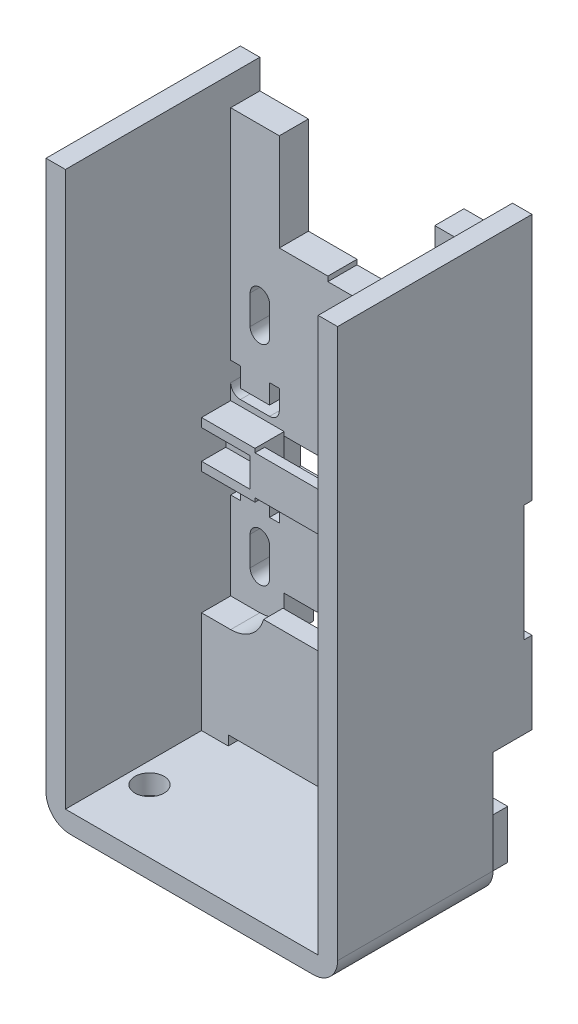
from build123d import *

# Parameters (mm, degrees)
BOSS_EXTRUDE1_DEPTH = 20
CUT_EXTRUDE1_DEPTH  = 39.668462602
CUT_EXTRUDE2_DEPTH  = 39.668462602
SKETCH4_W           = 26
SKETCH4_H           = 57
CUT_EXTRUDE3_DEPTH  = 14
CUT_EXTRUDE4_DEPTH  = 0.8
CUT_EXTRUDE5_DEPTH  = 39.260815464
CUT_EXTRUDE6_DEPTH  = 4
SKETCH8_W           = 5
SKETCH8_H           = 6.5
BOSS_EXTRUDE2_DEPTH = 1
SKETCH9_W           = 20.5
SKETCH9_H           = 1
CUT_EXTRUDE7_DEPTH  = 39.668462602
SKETCH10_W          = 11.5
SKETCH10_H          = 2
CUT_EXTRUDE8_DEPTH  = 1
CUT_EXTRUDE9_DEPTH  = 3
CUT_EXTRUDE10_REACH = 40.668
SKETCH12_W          = 15
SKETCH12_H          = 2
SKETCH13_W          = 16
SKETCH13_H          = 4
CUT_EXTRUDE11_DEPTH = 2.2
SKETCH14_W          = 5
SKETCH14_H          = 3
CUT_EXTRUDE12_DEPTH = 2.5
CUT_EXTRUDE13_REACH = 66.078
SKETCH15_R          = 1.5


with BuildPart() as part:
    # Sketch1 → Boss-Extrude1 (new body)
    with BuildSketch(Plane.XY):
        with BuildLine():
            Line((-15, 29.5), (15, 29.5))
            Line((15, 29.5), (15, -27))
            ThreePointArc((15, -27), (14.267766953, -28.767766953), (12.5, -29.5))
            Line((12.5, -29.5), (-12.5, -29.5))
            ThreePointArc((-12.5, -29.5), (-14.267766953, -28.767766953), (-15, -27))
            Line((-15, -27), (-15, 29.5))
        make_face()
    extrude(amount=BOSS_EXTRUDE1_DEPTH)

    # Sketch2 → Cut-Extrude1 (cut, through all)
    with BuildSketch(Plane(origin=(0, 0, 0), x_dir=(-1, 0, 0), z_dir=(0, 0, -1))):
        Polygon((-13, 29.5), (-13, 26.5), (-8, 26.5), (-8, 16.5), (-3, 16.5), (-3, 16), (3, 16), (3, 16.5), (8, 16.5), (8, 26.5), (13, 26.5), (13, 29.5), align=None)
    extrude(amount=-CUT_EXTRUDE1_DEPTH, mode=Mode.SUBTRACT)

    # Sketch3 → Cut-Extrude2 (cut, through all)
    with BuildSketch(Plane(origin=(0, 0, 0), x_dir=(-1, 0, 0), z_dir=(0, 0, -1))):
        with BuildLine():
            Line((-9, 11), (-9, 8))
            ThreePointArc((-9, 8), (-10, 7), (-11, 8))
            Line((-11, 8), (-11, 11))
            ThreePointArc((-11, 11), (-10, 12), (-9, 11))
        make_face()
        with BuildLine():
            Line((9, 8), (9, 11))
            ThreePointArc((9, 11), (10, 12), (11, 11))
            Line((11, 11), (11, 8))
            ThreePointArc((11, 8), (10, 7), (9, 8))
        make_face()
        with BuildLine():
            Line((9, -13.5), (9, -10.5))
            ThreePointArc((9, -10.5), (10, -9.5), (11, -10.5))
            Line((11, -10.5), (11, -13.5))
            ThreePointArc((11, -13.5), (10, -14.5), (9, -13.5))
        make_face()
        with BuildLine():
            Line((-9, -10.5), (-9, -13.5))
            ThreePointArc((-9, -13.5), (-10, -14.5), (-11, -13.5))
            Line((-11, -13.5), (-11, -10.5))
            ThreePointArc((-11, -10.5), (-10, -9.5), (-9, -10.5))
        make_face()
    extrude(amount=-CUT_EXTRUDE2_DEPTH, mode=Mode.SUBTRACT)

    # Sketch4 → Cut-Extrude3 (cut)
    with BuildSketch(Plane.XY.offset(20)):
        with Locations((0, 1)):
            Rectangle(SKETCH4_W, SKETCH4_H)
    extrude(amount=-CUT_EXTRUDE3_DEPTH, mode=Mode.SUBTRACT)

    # Sketch5 → Cut-Extrude4 (cut)
    with BuildSketch(Plane(origin=(0, 0, 0), x_dir=(-1, 0, 0), z_dir=(0, 0, -1))):
        Polygon((-15, 4), (-12, 4), (-12, 2), (-9, 2), (-9, 4), (9, 4), (9, 2), (12, 2), (12, 4), (15, 4), (15, -8), (12, -8), (12, -6), (9, -6), (9, -8), (5.5, -8), (5.5, -14), (-5.5, -14), (-5.5, -8), (-9, -8), (-9, -6), (-12, -6), (-12, -8), (-15, -8), align=None)
    extrude(amount=-CUT_EXTRUDE4_DEPTH, mode=Mode.SUBTRACT)

    # Sketch6 → Cut-Extrude5 (cut, through all)
    with BuildSketch(Plane(origin=(0, 0, 0.8), x_dir=(-1, 0, 0), z_dir=(0, 0, -1))):
        with BuildLine():
            Line((-12, 4), (-12, 2))
            Line((-12, 2), (-9, 2))
            Line((-9, 2), (-9, 4))
            Line((-9, 4), (-8, 4))
            Line((-8, 4), (-8, 2))
            ThreePointArc((-8, 2), (-8.292893219, 1.292893219), (-9, 1))
            Line((-9, 1), (-12, 1))
            ThreePointArc((-12, 1), (-12.707106781, 1.292893219), (-13, 2))
            Line((-13, 2), (-13, 4))
            Line((-13, 4), (-12, 4))
        make_face()
        with BuildLine():
            Line((13, 4), (12, 4))
            Line((12, 4), (12, 2))
            Line((12, 2), (9, 2))
            Line((9, 2), (9, 4))
            Line((9, 4), (8, 4))
            Line((8, 4), (8, 2))
            ThreePointArc((8, 2), (8.292893219, 1.292893219), (9, 1))
            Line((9, 1), (12, 1))
            ThreePointArc((12, 1), (12.707106781, 1.292893219), (13, 2))
            Line((13, 2), (13, 4))
        make_face()
        with BuildLine():
            Line((12, -8), (12, -6))
            Line((12, -6), (9, -6))
            Line((9, -6), (9, -8))
            Line((9, -8), (8, -8))
            Line((8, -8), (8, -6))
            ThreePointArc((8, -6), (8.292893219, -5.292893219), (9, -5))
            Line((9, -5), (12, -5))
            ThreePointArc((12, -5), (12.707106781, -5.292893219), (13, -6))
            Line((13, -6), (13, -8))
            Line((13, -8), (12, -8))
        make_face()
        with BuildLine():
            Line((-13, -8), (-12, -8))
            Line((-12, -8), (-12, -6))
            Line((-12, -6), (-9, -6))
            Line((-9, -6), (-9, -8))
            Line((-9, -8), (-8, -8))
            Line((-8, -8), (-8, -6))
            ThreePointArc((-8, -6), (-8.292893219, -5.292893219), (-9, -5))
            Line((-9, -5), (-12, -5))
            ThreePointArc((-12, -5), (-12.707106781, -5.292893219), (-13, -6))
            Line((-13, -6), (-13, -8))
        make_face()
    extrude(amount=-CUT_EXTRUDE5_DEPTH, mode=Mode.SUBTRACT)

    # Sketch7 → Cut-Extrude6 (cut)
    with BuildSketch(Plane(origin=(0, 0, 0), x_dir=(-1, 0, 0), z_dir=(0, 0, -1))):
        with BuildLine():
            Line((-7.5, -14), (7.5, -14))
            Line((7.5, -14), (7.5, -18))
            Line((7.5, -18), (10.828862426, -19.921919618))
            Line((10.828862426, -19.921919618), (15, -16.421919618))
            Line((15, -16.421919618), (15, -27))
            ThreePointArc((15, -27), (14.267766953, -28.767766953), (12.5, -29.5))
            Line((12.5, -29.5), (12.5, -24.5))
            Line((12.5, -24.5), (-12.5, -24.5))
            Line((-12.5, -24.5), (-12.5, -29.5))
            ThreePointArc((-12.5, -29.5), (-14.267766953, -28.767766953), (-15, -27))
            Line((-15, -27), (-15, -16.421919618))
            Line((-15, -16.421919618), (-10.828862426, -19.921919618))
            Line((-10.828862426, -19.921919618), (-7.5, -18))
            Line((-7.5, -18), (-7.5, -14))
        make_face()
    extrude(amount=-CUT_EXTRUDE6_DEPTH, mode=Mode.SUBTRACT)

    # Sketch8 → Boss-Extrude2 (add)
    with BuildSketch(Plane(origin=(0, 0, 4), x_dir=(-1, 0, 0), z_dir=(0, 0, -1))):
        with Locations((-10, -21.25)):
            Rectangle(SKETCH8_W, SKETCH8_H)
        with Locations((10, -21.25)):
            Rectangle(SKETCH8_W, SKETCH8_H)
    extrude(amount=BOSS_EXTRUDE2_DEPTH)

    # Sketch9 → Cut-Extrude7 (cut, through all)
    with BuildSketch(Plane(origin=(0, 0, 0), x_dir=(-1, 0, 0), z_dir=(0, 0, -1))):
        with Locations((0, -27)):
            Rectangle(SKETCH9_W, SKETCH9_H)
    extrude(amount=-CUT_EXTRUDE7_DEPTH, mode=Mode.SUBTRACT)

    # Sketch10 → Cut-Extrude8 (cut)
    with BuildSketch(Plane(origin=(0, 0, 0), x_dir=(-1, 0, 0), z_dir=(0, 0, -1))):
        with Locations((0, -25.5)):
            Rectangle(SKETCH10_W, SKETCH10_H)
    extrude(amount=-CUT_EXTRUDE8_DEPTH, mode=Mode.SUBTRACT)

    # Sketch11 → Cut-Extrude9 (cut)
    with BuildSketch(Plane.XY.offset(6)):
        Polygon((-13, 26.5), (-13, 0.4), (-7.5, 0.4), (-7.5, 0), (7.5, 0), (7.5, 0.4), (13, 0.4), (13, 26.5), align=None)
        with BuildLine():
            Line((7.5, -4.4), (13, -4.4))
            Line((13, -4.4), (13, -17))
            Line((13, -17), (10, -17))
            ThreePointArc((10, -17), (7.869334998, -16.276736691), (6.619259608, -14.405866658))
            Line((6.619259608, -14.405866658), (-6.619259608, -14.405866658))
            ThreePointArc((-6.619259608, -14.405866658), (-7.869334998, -16.276736691), (-10, -17))
            Line((-10, -17), (-13, -17))
            Line((-13, -17), (-13, -4.4))
            Line((-13, -4.4), (-7.5, -4.4))
            Line((-7.5, -4.4), (-7.5, -4))
            Line((-7.5, -4), (7.5, -4))
            Line((7.5, -4), (7.5, -4.4))
        make_face()
    extrude(amount=-CUT_EXTRUDE9_DEPTH, mode=Mode.SUBTRACT)

    # Sketch12 → Cut-Extrude10 (cut, up to next)
    with BuildSketch(Plane(origin=(0, 0, 0), x_dir=(1, 0, 0), z_dir=(0, 1, 0)), mode=Mode.PRIVATE) as cut_extrude10_sk1:
        with Locations((0, -4)):
            Rectangle(SKETCH12_W, SKETCH12_H)
    cut_extrude10_tool1 = extrude(cut_extrude10_sk1.sketch, amount=-CUT_EXTRUDE10_REACH, mode=Mode.PRIVATE) & part.part
    add(cut_extrude10_tool1.solids().sort_by_distance((0, 0, 4))[0], mode=Mode.SUBTRACT)

    # Sketch13 → Cut-Extrude11 (cut)
    with BuildSketch(Plane(origin=(0, 0, 0.8), x_dir=(-1, 0, 0), z_dir=(0, 0, -1))):
        with Locations((0, -2)):
            Rectangle(SKETCH13_W, SKETCH13_H)
    extrude(amount=-CUT_EXTRUDE11_DEPTH, mode=Mode.SUBTRACT)

    # Sketch14 → Cut-Extrude12 (cut)
    with BuildSketch(Plane.XY.offset(6)):
        with Locations((-10.5, -2)):
            Rectangle(SKETCH14_W, SKETCH14_H)
        with Locations((10.5, -2)):
            Rectangle(SKETCH14_W, SKETCH14_H)
    extrude(amount=-CUT_EXTRUDE12_DEPTH, mode=Mode.SUBTRACT)

    # Sketch15 → Cut-Extrude13 (cut, up to next)
    with BuildSketch(Plane.XZ.offset(29.5), mode=Mode.PRIVATE) as cut_extrude13_sk1:
        with Locations((-10.85, 13.5)):
            Circle(SKETCH15_R)
    cut_extrude13_tool1 = extrude(cut_extrude13_sk1.sketch, amount=-CUT_EXTRUDE13_REACH, mode=Mode.PRIVATE) & part.part
    # Sketch15 → Cut-Extrude13 (cut, up to next)
    with BuildSketch(Plane.XZ.offset(29.5), mode=Mode.PRIVATE) as cut_extrude13_sk2:
        with Locations((10.85, 13.5)):
            Circle(SKETCH15_R)
    cut_extrude13_tool2 = extrude(cut_extrude13_sk2.sketch, amount=-CUT_EXTRUDE13_REACH, mode=Mode.PRIVATE) & part.part
    add(cut_extrude13_tool1.solids().sort_by_distance((-10.85, -29.5, 13.5))[0], mode=Mode.SUBTRACT)
    add(cut_extrude13_tool2.solids().sort_by_distance((10.85, -29.5, 13.5))[0], mode=Mode.SUBTRACT)


solid = part.part
